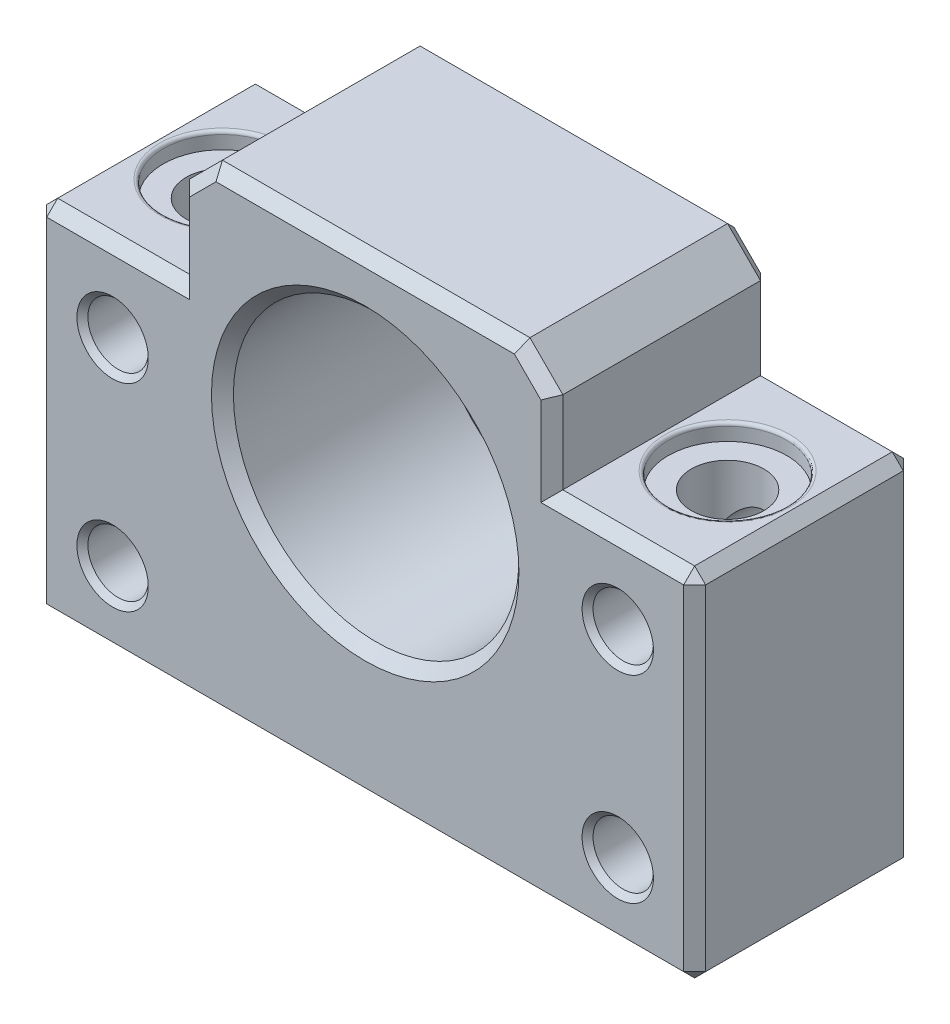
from build123d import *

# Parameters (mm, degrees)
SKETCH1_R           = 13
BOSS_EXTRUDE1_DEPTH = 20
CHAMFER1_SIZE       = 3
CHAMFER2_SIZE       = 1
SKETCH2_R           = 2.75
CUT_EXTRUDE1_DEPTH  = 57.115951386
CUT_EXTRUDE2_REACH  = 58.116
SKETCH3_R           = 3.3
SKETCH4_R           = 5.4
CUT_EXTRUDE3_DEPTH  = 1.5
CHAMFER3_SIZE       = 0.5
FILLET1_R           = 0.3


with BuildPart() as part:
    # Sketch1 → Boss-Extrude1 (new body)
    with BuildSketch(Plane.XY):
        Polygon((17, 0), (-17, 0), (-17, -10.5), (-30, -10.5), (-30, -43), (30, -43), (30, -10.5), (17, -10.5), align=None)
        with Locations((0, -18)):
            Circle(SKETCH1_R, mode=Mode.SUBTRACT)
    extrude(amount=BOSS_EXTRUDE1_DEPTH)

    # Chamfer1
    chamfer1_edges = [part.edges().sort_by_distance(p)[0] for p in [
        (17, 0, 10),
        (-17, 0, 10),
    ]]
    chamfer(chamfer1_edges, length=CHAMFER1_SIZE)

    # Chamfer2
    chamfer2_edges = [part.edges().sort_by_distance(p)[0] for p in [
        (0, -43, 0),
        (-30, -43, 10),
        (-30, -26.75, 0),
        (0, -43, 20),
        (30, -43, 10),
        (30, -26.75, 0),
        (17, -6.75, 0),
        (15.5, -1.5, 0),
        (0, 0, 0),
        (-15.5, -1.5, 0),
        (-17, -6.75, 0),
        (-23.5, -10.5, 0),
        (-30, -10.5, 10),
        (23.5, -10.5, 0),
        (30, -10.5, 10),
        (30, -26.75, 20),
        (23.5, -10.5, 20),
        (17, -6.75, 20),
        (15.5, -1.5, 20),
        (0, 0, 20),
        (-15.5, -1.5, 20),
        (-17, -6.75, 20),
        (-23.5, -10.5, 20),
        (-30, -26.75, 20),
        (-13, -18, 20),
        (-13, -18, 0),
    ]]
    chamfer(chamfer2_edges, length=CHAMFER2_SIZE)

    # Sketch2 → Cut-Extrude1 (cut, through all)
    with BuildSketch(Plane(origin=(0, 0, 0), x_dir=(-1, 0, 0), z_dir=(0, 0, -1))):
        with Locations((-23, -18)):
            Circle(SKETCH2_R)
        with Locations((23, -18)):
            Circle(SKETCH2_R)
        with Locations((23, -36)):
            Circle(SKETCH2_R)
        with Locations((-23, -36)):
            Circle(SKETCH2_R)
    extrude(amount=-CUT_EXTRUDE1_DEPTH, mode=Mode.SUBTRACT)

    # Sketch3 → Cut-Extrude2 (cut, up to next)
    with BuildSketch(Plane.XZ.offset(43), mode=Mode.PRIVATE) as cut_extrude2_sk1:
        with Locations((23, 10)):
            Circle(SKETCH3_R)
    cut_extrude2_tool1 = extrude(cut_extrude2_sk1.sketch, amount=-CUT_EXTRUDE2_REACH, mode=Mode.PRIVATE) & part.part
    # Sketch3 → Cut-Extrude2 (cut, up to next)
    with BuildSketch(Plane.XZ.offset(43), mode=Mode.PRIVATE) as cut_extrude2_sk2:
        with Locations((-23, 10)):
            Circle(SKETCH3_R)
    cut_extrude2_tool2 = extrude(cut_extrude2_sk2.sketch, amount=-CUT_EXTRUDE2_REACH, mode=Mode.PRIVATE) & part.part
    add(cut_extrude2_tool1.solids().sort_by_distance((23, -43, 10))[0], mode=Mode.SUBTRACT)
    add(cut_extrude2_tool2.solids().sort_by_distance((-23, -43, 10))[0], mode=Mode.SUBTRACT)

    # Sketch4 → Cut-Extrude3 (cut)
    with BuildSketch(Plane(origin=(0, -10.5, 0), x_dir=(1, 0, 0), z_dir=(0, 1, 0))):
        with Locations((23, -10)):
            Circle(SKETCH4_R)
        with Locations((-23, -10)):
            Circle(SKETCH4_R)
    extrude(amount=-CUT_EXTRUDE3_DEPTH, mode=Mode.SUBTRACT)

    # Chamfer3
    chamfer3_edges = [part.edges().sort_by_distance(p)[0] for p in [
        (19.7, -43, 10),
        (-26.3, -43, 10),
        (-20.25, -36, 20),
        (-20.25, -18, 20),
        (25.75, -36, 20),
        (25.75, -18, 20),
        (-20.25, -18, 0),
        (-20.25, -36, 0),
        (25.75, -36, 0),
        (25.75, -18, 0),
    ]]
    chamfer(chamfer3_edges, length=CHAMFER3_SIZE)

    # Fillet1
    fillet1_edges = [part.edges().sort_by_distance(p)[0] for p in [
        (17.6, -10.5, 10),
        (-28.4, -10.5, 10),
    ]]
    fillet(fillet1_edges, radius=FILLET1_R)


solid = part.part
